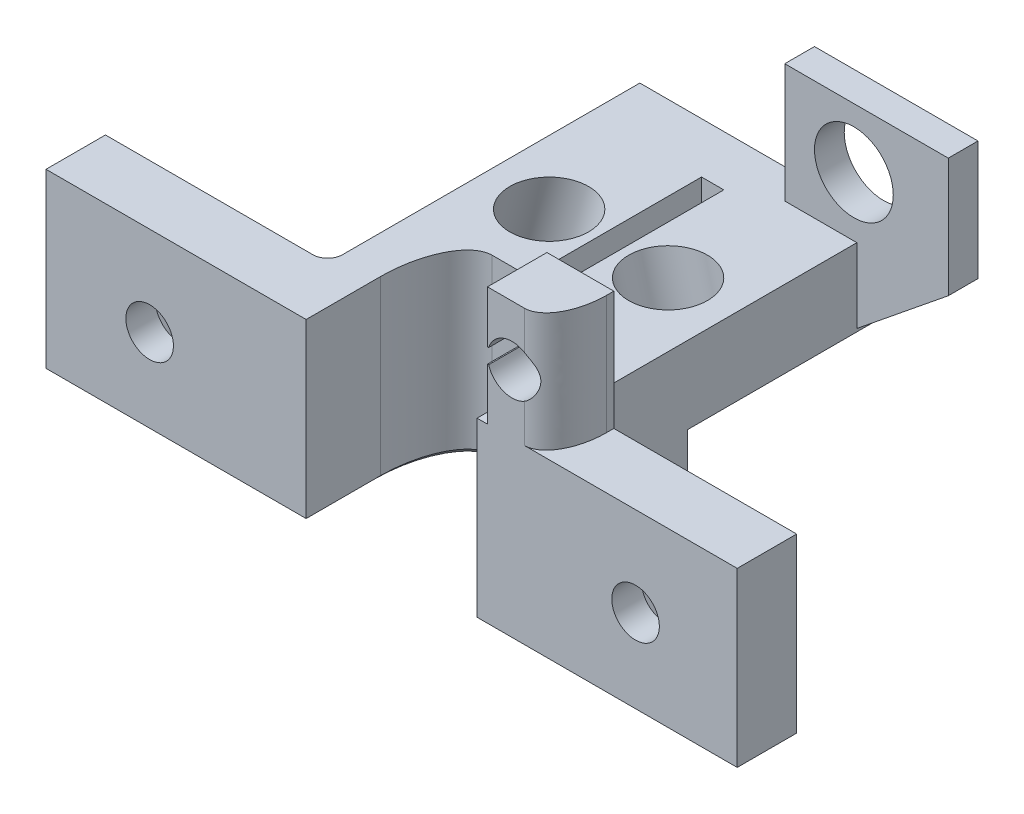
from build123d import *

# Parameters (mm, degrees)
BOSS_EXTRUDE1_DEPTH = 12
CUT_EXTRUDE1_DEPTH  = 2
SKETCH3_W           = 16.6
SKETCH3_H           = 13.4
BOSS_EXTRUDE2_DEPTH = 5.2
SKETCH5_R           = 1.6
CUT_EXTRUDE2_DEPTH  = 5
SKETCH6_W           = 4.5
SKETCH6_H           = 4
BOSS_EXTRUDE4_DEPTH = 8
CUT_EXTRUDE4_DEPTH  = 7
SKETCH8_R           = 2.65
CUT_EXTRUDE5_DEPTH  = 7
SKETCH10_R          = 2.65
CUT_EXTRUDE6_DEPTH  = 7
CHAMFER2_SIZE       = 2
SKETCH12_W          = 3
SKETCH12_H          = 2
SKETCH12_W_2        = 6.148694825
SKETCH12_W_3        = 1.851305175
BOSS_EXTRUDE5_DEPTH = 8
SKETCH13_R          = 2.65
CUT_EXTRUDE7_DEPTH  = 3
CHAMFER4_SIZE       = 5
CHAMFER4_SIZE_2     = 6.174485783
SKETCH16_W          = 1.5
SKETCH16_H          = 10
CUT_EXTRUDE8_DEPTH  = 11
CHAMFER5_SIZE       = 0.4
FILLET1_SIZE        = 2
FILLET1_SIZE_2      = 3.5


with BuildPart() as part:
    # Sketch1 → Boss-Extrude1 (new body)
    with BuildSketch(Plane(origin=(0, 0, 0), x_dir=(1, 0, 0), z_dir=(0, 1, 0))):
        with BuildLine():
            Line((-23.25, -5), (-5.749755012, -5))
            Line((-5.749755012, -5), (-5.749755012, 0))
            add(Edge.make_bspline(
                [(-3.25, 5), (-5.749755012, 5), (-5.749755012, 0)],
                knots=[0, 0, 0, 1.570796327, 1.570796327, 1.570796327], degree=2, weights=[1, 0.707106781, 1]))
            Line((-3.25, 5), (3.25, 5))
            add(Edge.make_bspline(
                [(5.748694825, 0), (5.748694825, 5), (3.25, 5)],
                knots=[4.71238898, 4.71238898, 4.71238898, 6.283185307, 6.283185307, 6.283185307], degree=2, weights=[1, 0.707106781, 1]))
            Line((5.748694825, 0), (5.748694825, -5))
            Line((5.748694825, -5), (23.25, -5))
            Line((23.25, -5), (23.25, -3))
            Line((23.25, -3), (23.25, -1))
            Line((23.25, -1), (9.3, -1))
            ThreePointArc((9.3, -1), (8.592893219, -0.707106781), (8.3, 0))
            Line((8.3, 0), (8.3, 6.6))
            Line((8.3, 6.6), (-8.3, 6.6))
            Line((-8.3, 6.6), (-8.3, 0))
            ThreePointArc((-8.3, 0), (-8.592893219, -0.707106781), (-9.3, -1))
            Line((-9.3, -1), (-23.25, -1))
            Line((-23.25, -1), (-23.25, -5))
        make_face()
    extrude(amount=BOSS_EXTRUDE1_DEPTH)

    # Sketch2 → Cut-Extrude1 (cut)
    with BuildSketch(Plane(origin=(0, 0, 1), x_dir=(-1, 0, 0), z_dir=(0, 0, -1))):
        Polygon((20.147177825, 6), (18.213054423, 9.35), (14.344807619, 9.35), (12.410684218, 6), (14.344807619, 2.65), (18.213054423, 2.65), align=None)
        Polygon((-12.542169585, 6), (-14.476292987, 9.35), (-18.34453979, 9.35), (-20.278663192, 6), (-18.34453979, 2.65), (-14.476292987, 2.65), align=None)
    extrude(amount=-CUT_EXTRUDE1_DEPTH, mode=Mode.SUBTRACT)

    # Sketch3 → Boss-Extrude2 (add)
    with BuildSketch(Plane(origin=(0, 12, 0), x_dir=(1, 0, 0), z_dir=(0, 1, 0))):
        with Locations((0, 13.3)):
            Rectangle(SKETCH3_W, SKETCH3_H)
    extrude(amount=-BOSS_EXTRUDE2_DEPTH)

    # Sketch5 → Cut-Extrude2 (cut)
    with BuildSketch(Plane(origin=(0, 0, 1), x_dir=(-1, 0, 0), z_dir=(0, 0, -1))):
        with Locations((-16.410416388, 6)):
            Circle(SKETCH5_R)
        with Locations((16.278931021, 6)):
            Circle(SKETCH5_R)
    extrude(amount=-CUT_EXTRUDE2_DEPTH, mode=Mode.SUBTRACT)

    # Sketch6 → Boss-Extrude4 (add)
    with BuildSketch(Plane(origin=(0, 12, 0), x_dir=(1, 0, 0), z_dir=(0, 1, 0))):
        with Locations((8.698694825, -3)):
            Rectangle(SKETCH6_W, SKETCH6_H)
    extrude(amount=BOSS_EXTRUDE4_DEPTH)

    # Sketch7 → Cut-Extrude4 (cut)
    with BuildSketch(Plane(origin=(0, 0, 1), x_dir=(-1, 0, 0), z_dir=(0, 0, -1))):
        with BuildLine():
            ThreePointArc((-6.448694825, 16), (-6.468205549, 16.252991544), (-6.526276305, 16.5))
            Line((-6.526276305, 16.5), (-7.999397269, 16.5))
            Line((-7.999397269, 16.5), (-7.999397269, 15.5))
            Line((-7.999397269, 15.5), (-6.526276305, 15.5))
            ThreePointArc((-6.526276305, 15.5), (-6.468205549, 15.747008456), (-6.448694825, 16))
        make_face()
        with BuildLine():
            Line((-7.999397269, 16.5), (-6.526276305, 16.5))
            ThreePointArc((-6.526276305, 16.5), (-9.748694825, 16), (-6.526276305, 15.5))
            Line((-6.526276305, 15.5), (-7.999397269, 15.5))
            Line((-7.999397269, 15.5), (-7.999397269, 16.5))
        make_face()
        with BuildLine():
            Line((-6.448694825, 15.5), (-6.448694825, 16))
            ThreePointArc((-6.448694825, 16), (-6.468205549, 15.747008456), (-6.526276305, 15.5))
            Line((-6.526276305, 15.5), (-6.448694825, 15.5))
        make_face()
        with BuildLine():
            Line((-6.448694825, 16), (-6.448694825, 16.5))
            Line((-6.448694825, 16.5), (-6.526276305, 16.5))
            ThreePointArc((-6.526276305, 16.5), (-6.468205549, 16.252991544), (-6.448694825, 16))
        make_face()
    extrude(amount=-CUT_EXTRUDE4_DEPTH, mode=Mode.SUBTRACT)

    # Sketch8 → Cut-Extrude5 (cut, along a direction that is not the sketch's normal)
    with BuildSketch(Plane(origin=(0, 12, 0), x_dir=(1, 0, 0), z_dir=(0, 1, 0))):
        with Locations((-4, 9.6)):
            Circle(SKETCH8_R)
    extrude(amount=-CUT_EXTRUDE5_DEPTH, dir=(0.2588190451025147, 0.96592582628907, -1.457918124587514e-13), mode=Mode.SUBTRACT)

    # Sketch10 → Cut-Extrude6 (cut, along a direction that is not the sketch's normal)
    with BuildSketch(Plane(origin=(0, 12, 0), x_dir=(1, 0, 0), z_dir=(0, 1, 0))):
        with Locations((4, 9.6)):
            Circle(SKETCH10_R)
    extrude(amount=-CUT_EXTRUDE6_DEPTH, dir=(-0.25881904510251447, 0.96592582628907, 0), mode=Mode.SUBTRACT)

    # Chamfer2
    chamfer2_edges = [part.edges().sort_by_distance(p)[0] for p in [
        (7.874347412, 12, 1),
    ]]
    chamfer(chamfer2_edges, length=CHAMFER2_SIZE)

    # Sketch12 → Boss-Extrude5 (add)
    with BuildSketch(Plane(origin=(0, 12, 0), x_dir=(1, 0, 0), z_dir=(0, 1, 0))):
        with Locations((4.948694825, 19)):
            Rectangle(SKETCH12_W, SKETCH12_H)
        with Locations((11.374347413, 19)):
            Rectangle(SKETCH12_W_2, SKETCH12_H)
        with Locations((7.374347413, 19)):
            Rectangle(SKETCH12_W_3, SKETCH12_H)
    extrude(amount=BOSS_EXTRUDE5_DEPTH)

    # Sketch13 → Cut-Extrude7 (cut)
    with BuildSketch(Plane(origin=(0, 0, -20), x_dir=(-1, 0, 0), z_dir=(0, 0, -1))):
        with Locations((-8.098694825, 16)):
            Circle(SKETCH13_R)
    extrude(amount=-CUT_EXTRUDE7_DEPTH, mode=Mode.SUBTRACT)

    # Chamfer4
    # the kernel refuses this chamfer: 6.174485783, 5 mm, written as the material it adds along each edge
    with BuildSketch(Plane(origin=(8.3, 12, -18), x_dir=(-0.037204697112204525, -0.9993076655929289, 0), z_dir=(0, 0, -1))) as chamfer4_piece_1_section:
        Polygon((CHAMFER4_SIZE * 0.999307665593, -CHAMFER4_SIZE * 0.0372046971122), (-CHAMFER4_SIZE_2 * 0.0372046971102, -CHAMFER4_SIZE_2 * 0.99930766554), (0, 0), align=None)
    chamfer4_piece_1 = extrude(amount=2, mode=Mode.PRIVATE)
    chamfer4_piece_1 = split(chamfer4_piece_1, bisect_by=Plane(origin=(14.448694825, 10.333304375, -19), z_dir=(-1, 0, 0)), keep=Keep.TOP, mode=Mode.PRIVATE)
    add(chamfer4_piece_1)

    # Sketch16 → Cut-Extrude8 (cut)
    with BuildSketch(Plane.XZ.offset(-6.8)):
        with Locations((0, -11.6)):
            Rectangle(SKETCH16_W, SKETCH16_H)
    extrude(amount=-CUT_EXTRUDE8_DEPTH, mode=Mode.SUBTRACT)

    # Chamfer5
    chamfer5_edges = [part.edges().sort_by_distance(p)[0] for p in [
        (0, 0, -5),
        (-5.260112096, 0, -2.972310439),
        (-5.749755012, 0, 2.5),
        (-14.499877506, 0, 5),
        (-23.25, 0, 3),
        (-16.275, 0, 1),
        (-8.592893219, 0, 0.707106781),
        (-8.3, 0, -3.3),
        (0, 0, -6.6),
        (8.3, 0, -3.3),
        (8.592893219, 0, 0.707106781),
        (16.275, 0, 1),
        (23.25, 0, 3),
        (14.499347412, 0, 5),
        (5.748694825, 0, 2.5),
        (5.259369228, 0, -2.972013605),
    ]]
    chamfer(chamfer5_edges, length=CHAMFER5_SIZE)

    # Fillet1
    # an asymmetric fillet: 3.5, 2 mm, written as the material it takes off along each edge
    with BuildSketch(Plane(origin=(10.948694825, 12, 5), x_dir=(-1, 0, 0), z_dir=(0, 1, 0))) as fillet1_piece_1:
        with BuildLine():
            Bezier((FILLET1_SIZE, 0), (0, 0), (0, -FILLET1_SIZE_2), weights=[1, 0.707106781, 1])
            Line((0, -FILLET1_SIZE_2), (0, 0))
            Line((0, 0), (FILLET1_SIZE, 0))
        make_face()
    extrude(amount=16.75, mode=Mode.SUBTRACT)


solid = part.part
